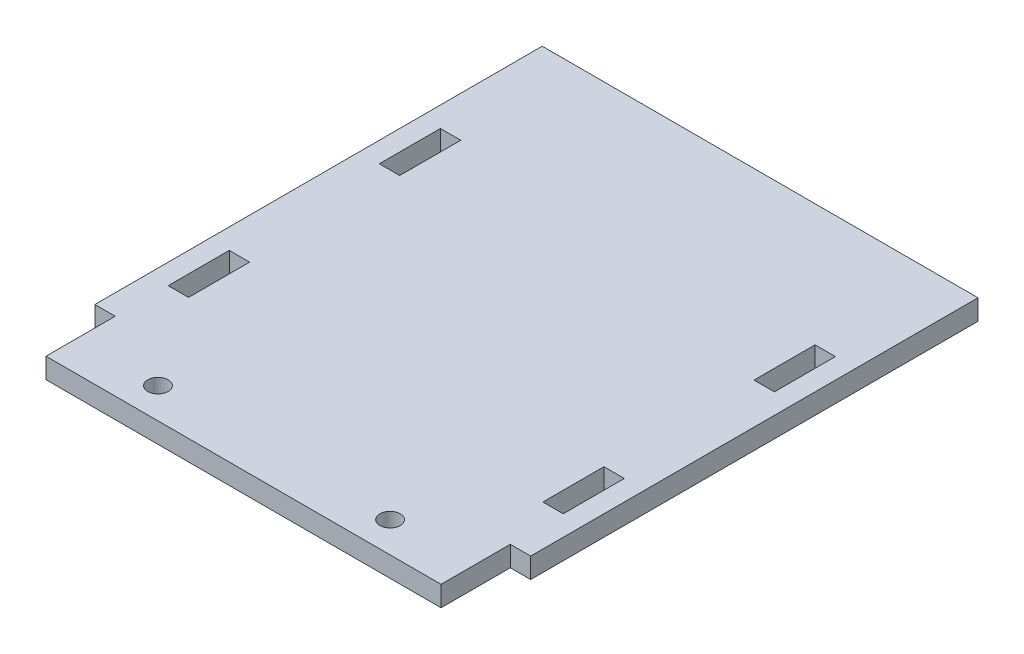
from build123d import *

# Parameters (mm, degrees)
SKETCH_1_R      = 2.5
SKETCH_1_W      = 5
SKETCH_1_H      = 15
EXTRUDE_1_DEPTH = 5


with BuildPart() as part:
    # 草图1 → 凸台-拉伸1 (new body)
    with BuildSketch(Plane(origin=(0, 0, 0), x_dir=(1, 0, 0), z_dir=(0, 1, 0))):
        Polygon((-48.5, -63.42), (48.5, -63.42), (48.5, -46.42), (53.5, -46.42), (53.5, 63.42), (-53.5, 63.42), (-53.5, -46.42), (-48.5, -46.42), align=None)
        with Locations((-28.5, -55.932603892)):
            Circle(SKETCH_1_R, mode=Mode.SUBTRACT)
        with Locations((28.5, -55.932603892)):
            Circle(SKETCH_1_R, mode=Mode.SUBTRACT)
        with Locations((46, 25.92)):
            Rectangle(SKETCH_1_W, SKETCH_1_H, mode=Mode.SUBTRACT)
        with Locations((46, -25.92)):
            Rectangle(SKETCH_1_W, SKETCH_1_H, mode=Mode.SUBTRACT)
        with Locations((-46, 25.92)):
            Rectangle(SKETCH_1_W, SKETCH_1_H, mode=Mode.SUBTRACT)
        with Locations((-46, -25.92)):
            Rectangle(SKETCH_1_W, SKETCH_1_H, mode=Mode.SUBTRACT)
    extrude(amount=EXTRUDE_1_DEPTH)


solid = part.part
